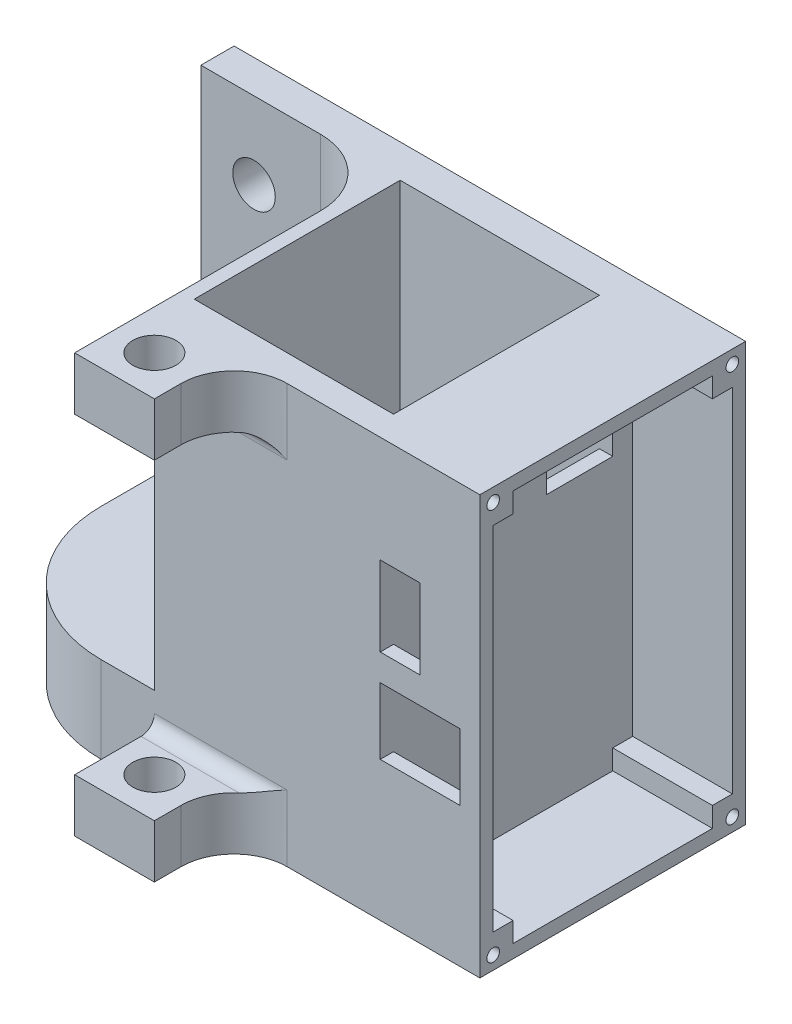
from build123d import *

# Parameters (mm, degrees)
SKETCH1_R           = 7.11
SKETCH1_R_2         = 7.5
BOSS_EXTRUDE1_DEPTH = 5
SKETCH2_W           = 30
SKETCH2_H           = 40
SKETCH2_R           = 12.520857117
BOSS_EXTRUDE2_DEPTH = 8
SKETCH3_R           = 1.5
SKETCH3_R_2         = 1.69090387
CUT_EXTRUDE1_DEPTH  = 49.301138703
SKETCH4_R           = 3
CUT_EXTRUDE2_DEPTH  = 4
SKETCH5_W           = 62
SKETCH5_H           = 5
SKETCH5_W_2         = 30
SKETCH5_H_2         = 4
BOSS_EXTRUDE3_DEPTH = 55
BOSS_EXTRUDE4_START = -5
BOSS_EXTRUDE4_DEPTH = 5
SKETCH7_W           = 2
SKETCH7_H           = 35
BOSS_EXTRUDE5_DEPTH = 50
SKETCH8_R           = 3.2
CUT_EXTRUDE3_DEPTH  = 50
BOSS_EXTRUDE6_START = 8
SKETCH9_R           = 3
BOSS_EXTRUDE6_DEPTH = 8
SKETCH10_W          = 40
SKETCH10_H          = 63
BOSS_EXTRUDE7_DEPTH = 15
SKETCH11_W          = 10
SKETCH11_H          = 15
CUT_EXTRUDE4_DEPTH  = 15
SKETCH12_W          = 6
SKETCH12_H          = 12
SKETCH12_W_2        = 12
SKETCH12_H_2        = 10
CUT_EXTRUDE5_DEPTH  = 15
SKETCH13_R          = 0.95
CUT_EXTRUDE6_DEPTH  = 15
SKETCH14_W          = 32.475514119
SKETCH14_H          = 38.926382417
CUT_EXTRUDE7_DEPTH  = 15
SKETCH15_W          = 12
SKETCH15_H          = 12
SKETCH15_R          = 3.25
BOSS_EXTRUDE8_DEPTH = 8
LPATTERN1_COUNT     = 2
LPATTERN1_PITCH     = 55
FILLET1_R           = 10
FILLET2_R           = 2
FILLET3_R           = 8


with BuildPart() as part:
    # Sketch1 → Boss-Extrude1 (new body)
    with BuildSketch(Plane(origin=(0, 0, 0), x_dir=(1, 0, 0), z_dir=(0, 1, 0))):
        with BuildLine():
            Line((42, 20), (-20, 20))
            Line((-20, 20), (-20, 0))
            ThreePointArc((-20, 0), (-14.142135624, -14.142135624), (0, -20))
            Line((0, -20), (42, -20))
            Line((42, -20), (42, 20))
        make_face()
        Circle(SKETCH1_R, mode=Mode.SUBTRACT)
        with Locations((25, 0)):
            Circle(SKETCH1_R_2, mode=Mode.SUBTRACT)
    extrude(amount=BOSS_EXTRUDE1_DEPTH)

    # Sketch2 → Boss-Extrude2 (add)
    with BuildSketch(Plane(origin=(0, 5, 0), x_dir=(1, 0, 0), z_dir=(0, 1, 0))):
        with Locations((25, 0)):
            Rectangle(SKETCH2_W, SKETCH2_H)
        with Locations((25, 0)):
            Circle(SKETCH2_R, mode=Mode.SUBTRACT)
    extrude(amount=BOSS_EXTRUDE2_DEPTH)

    # Sketch3 → Cut-Extrude1 (cut, through all)
    with BuildSketch(Plane.XZ):
        with Locations((13.5, 11.5)):
            Circle(SKETCH3_R)
        with Locations((36.5, 11.5)):
            Circle(SKETCH3_R)
        with Locations((13.5, -11.5)):
            Circle(SKETCH3_R_2)
        with Locations((36.5, -11.5)):
            Circle(SKETCH3_R)
    extrude(amount=-CUT_EXTRUDE1_DEPTH, mode=Mode.SUBTRACT)

    # Sketch4 → Cut-Extrude2 (cut)
    with BuildSketch(Plane.XZ):
        with Locations((13.5, 11.5)):
            Circle(SKETCH4_R)
        with Locations((36.5, 11.5)):
            Circle(SKETCH4_R)
        with Locations((36.5, -11.5)):
            Circle(SKETCH4_R)
        with Locations((13.5, -11.5)):
            Circle(SKETCH4_R)
    extrude(amount=-CUT_EXTRUDE2_DEPTH, mode=Mode.SUBTRACT)

    # Sketch5 → Boss-Extrude3 (add)
    with BuildSketch(Plane(origin=(0, 0, 0), x_dir=(1, 0, 0), z_dir=(0, 1, 0))):
        with Locations((11, 17.5)):
            Rectangle(SKETCH5_W, SKETCH5_H)
        with Locations((25, -18)):
            Rectangle(SKETCH5_W_2, SKETCH5_H_2)
    extrude(amount=BOSS_EXTRUDE3_DEPTH)

    # Sketch6 → Boss-Extrude4 (add)
    with BuildSketch(Plane(origin=(0, 55, 0), x_dir=(1, 0, 0), z_dir=(0, 1, 0)).offset(BOSS_EXTRUDE4_START)):
        with BuildLine():
            Line((-20, 20), (-20, 0))
            ThreePointArc((-20, 0), (-14.142135624, -14.142135624), (0, -20))
            Line((0, -20), (10, -20))
            Line((10, -20), (10, 20))
            Line((10, 20), (-20, 20))
        make_face()
    extrude(amount=BOSS_EXTRUDE4_DEPTH)

    # Sketch7 → Boss-Extrude5 (add)
    with BuildSketch(Plane(origin=(0, 5, 0), x_dir=(1, 0, 0), z_dir=(0, 1, 0))):
        with Locations((9, -2.5)):
            Rectangle(SKETCH7_W, SKETCH7_H)
        with Locations((41, -2.5)):
            Rectangle(SKETCH7_W, SKETCH7_H)
    extrude(amount=BOSS_EXTRUDE5_DEPTH)

    # Sketch8 → Cut-Extrude3 (cut)
    with BuildSketch(Plane.XY.offset(-15)):
        with Locations((-12, 18)):
            Circle(SKETCH8_R)
        with Locations((-12, 43.4)):
            Circle(SKETCH8_R)
    extrude(amount=-CUT_EXTRUDE3_DEPTH, mode=Mode.SUBTRACT)

    # Sketch9 → Boss-Extrude6 (add)
    with BuildSketch(Plane.XZ.offset(BOSS_EXTRUDE6_START)):
        with BuildLine():
            Line((42, 20), (0, 20))
            ThreePointArc((0, 20), (-14.142135624, 14.142135624), (-20, 0))
            Line((-20, 0), (-20, -20))
            Line((-20, -20), (-9.9e-08, -20))
            ThreePointArc((-9.9e-08, -20), (7.42564651, -18.570400478), (13.789723022, -14.485977323))
            ThreePointArc((13.789723022, -14.485977323), (12.607502865, -14.364166347), (11.565353431, -13.792845972))
            ThreePointArc((11.565353431, -13.792845972), (-18, 0), (11.565353431, 13.792845972))
            ThreePointArc((11.565353431, 13.792845972), (15.783729691, 13.445399367), (15.456109208, 9.225437017))
            ThreePointArc((15.456109208, 9.225437017), (16.299370876, 7.637441262), (16.98, 5.973240327))
            ThreePointArc((16.98, 5.973240327), (35, 0), (16.98, -5.973240327))
            ThreePointArc((16.98, -5.973240327), (16.299370876, -7.637441262), (15.456109208, -9.225437017))
            ThreePointArc((15.456109208, -9.225437017), (16.185846722, -10.163501819), (16.494060762, -11.311319975))
            ThreePointArc((16.494060762, -11.311319975), (17.082066056, -10.402068027), (17.62, -9.462325296))
            ThreePointArc((17.62, -9.462325296), (21.097943078, -11.34786111), (25, -12))
            Line((25, -12), (25, -20))
            Line((25, -20), (42, -20))
            Line((42, -20), (42, 20))
        make_face()
        with Locations((36.5, -11.5)):
            Circle(SKETCH9_R, mode=Mode.SUBTRACT)
        with Locations((36.5, 11.5)):
            Circle(SKETCH9_R, mode=Mode.SUBTRACT)
    extrude(amount=-BOSS_EXTRUDE6_DEPTH)

    # Sketch10 → Boss-Extrude7 (add)
    with BuildSketch(Plane(origin=(42, 0, 0), x_dir=(0, 0, -1), z_dir=(1, 0, 0))):
        with Locations((0, 23.5)):
            Rectangle(SKETCH10_W, SKETCH10_H)
        Polygon((-18, -3), (-18, 50), (-15, 50), (-15, 53), (15, 53), (15, 50), (18, 50), (18, -3), (15, -3), (15, -6), (-15, -6), (-15, -3), align=None, mode=Mode.SUBTRACT)
    extrude(amount=BOSS_EXTRUDE7_DEPTH)

    # Sketch11 → Cut-Extrude4 (cut)
    with BuildSketch(Plane(origin=(42, 0, 0), x_dir=(0, 0, -1), z_dir=(1, 0, 0))):
        with Locations((10, 42.5)):
            Rectangle(SKETCH11_W, SKETCH11_H)
    extrude(amount=-CUT_EXTRUDE4_DEPTH, mode=Mode.SUBTRACT)

    # Sketch12 → Cut-Extrude5 (cut)
    with BuildSketch(Plane.XY.offset(20)):
        with Locations((45, 33)):
            Rectangle(SKETCH12_W, SKETCH12_H)
        with Locations((48, 18)):
            Rectangle(SKETCH12_W_2, SKETCH12_H_2)
    extrude(amount=-CUT_EXTRUDE5_DEPTH, mode=Mode.SUBTRACT)

    # Sketch13 → Cut-Extrude6 (cut)
    with BuildSketch(Plane(origin=(57, 0, 0), x_dir=(0, 0, -1), z_dir=(1, 0, 0))):
        with Locations((-18, 53)):
            Circle(SKETCH13_R)
        with Locations((18, 53)):
            Circle(SKETCH13_R)
        with Locations((-18, -6)):
            Circle(SKETCH13_R)
        with Locations((18, -6)):
            Circle(SKETCH13_R)
    extrude(amount=-CUT_EXTRUDE6_DEPTH, mode=Mode.SUBTRACT)

    # Sketch14 → Cut-Extrude7 (cut)
    with BuildSketch(Plane(origin=(0, 55, 0), x_dir=(1, 0, 0), z_dir=(0, 1, 0))):
        with Locations((-8.23775706, -4.463191209)):
            Rectangle(SKETCH14_W, SKETCH14_H)
    extrude(amount=-CUT_EXTRUDE7_DEPTH, mode=Mode.SUBTRACT)

    # Sketch15 → Boss-Extrude8 (add)
    with BuildSketch(Plane(origin=(0, 0, 0), x_dir=(1, 0, 0), z_dir=(0, 1, 0))):
        with Locations((14, -26)):
            Rectangle(SKETCH15_W, SKETCH15_H)
        with Locations((14, -26)):
            Circle(SKETCH15_R, mode=Mode.SUBTRACT)
    boss_extrude8 = extrude(amount=-BOSS_EXTRUDE8_DEPTH)

    # LPattern1: Boss-Extrude8 ×2
    with Locations(*[(0, i * LPATTERN1_PITCH, 0) for i in range(1, LPATTERN1_COUNT)]):
        add(boss_extrude8)

    # Fillet1
    fillet1_edges = [part.edges().sort_by_distance(p)[0] for p in [
        (8, 22.5, -15),
    ]]
    fillet(fillet1_edges, radius=FILLET1_R)

    # Fillet2
    fillet2_edges = [part.edges().sort_by_distance(p)[0] for p in [
        (14, 0, 20),
        (14, 47, 20),
    ]]
    fillet(fillet2_edges, radius=FILLET2_R)

    # Fillet3
    fillet3_edges = [part.edges().sort_by_distance(p)[0] for p in [
        (20, -3, 20),
        (20, 50, 20),
    ]]
    fillet(fillet3_edges, radius=FILLET3_R)


solid = part.part
